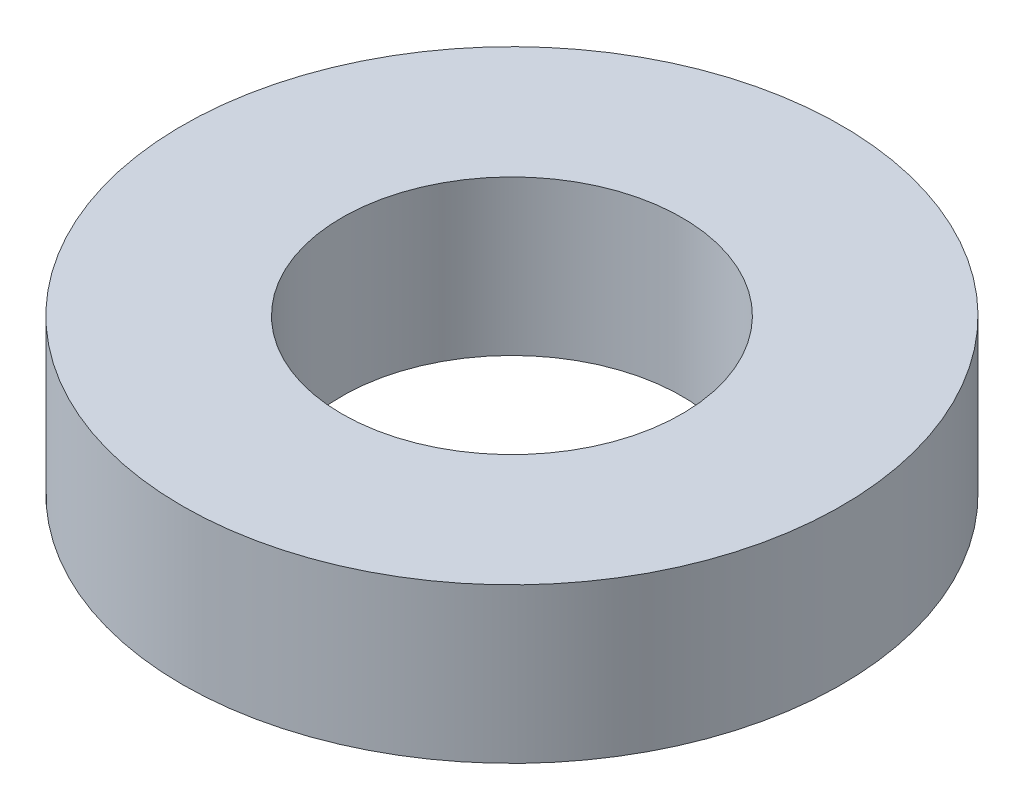
from build123d import *

# Parameters (mm, degrees)
SKETCH1_R           = 6.35
SKETCH1_R_2         = 3.2766
BOSS_EXTRUDE1_DEPTH = 2.97942


with BuildPart() as part:
    # Sketch1 → Boss-Extrude1 (new body)
    with BuildSketch(Plane(origin=(0, 0, 0), x_dir=(1, 0, 0), z_dir=(0, 1, 0))):
        Circle(SKETCH1_R)
        Circle(SKETCH1_R_2, mode=Mode.SUBTRACT)
    extrude(amount=BOSS_EXTRUDE1_DEPTH)


solid = part.part
